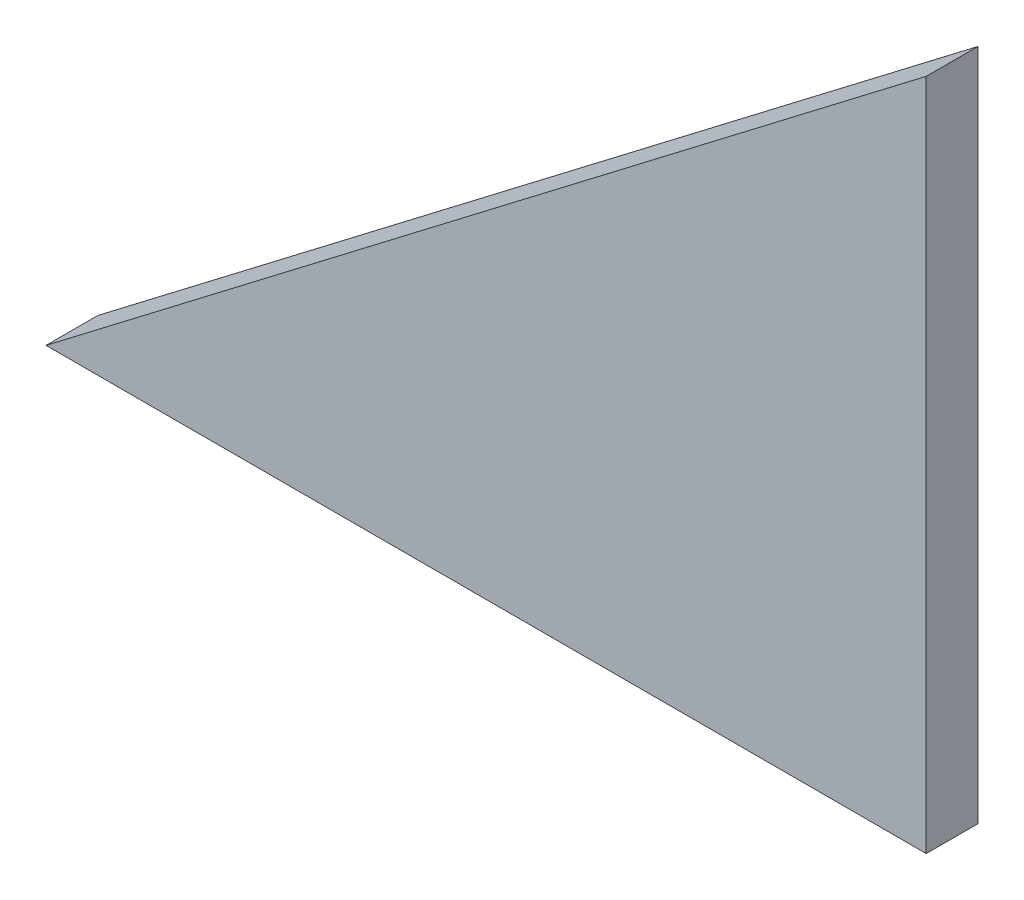
from build123d import *

# Parameters (mm, degrees)
TABAN_FLAN_1_DEPTH = 10


# Sheet-metal steps are written as plain solids
with BuildPart() as part:
    # Çizim1 → Taban-Flanş1 (new body)
    with BuildSketch(Plane.XY):
        Polygon((0, 0), (170, 0), (170, 130), align=None)
    extrude(amount=-TABAN_FLAN_1_DEPTH)


solid = part.part
